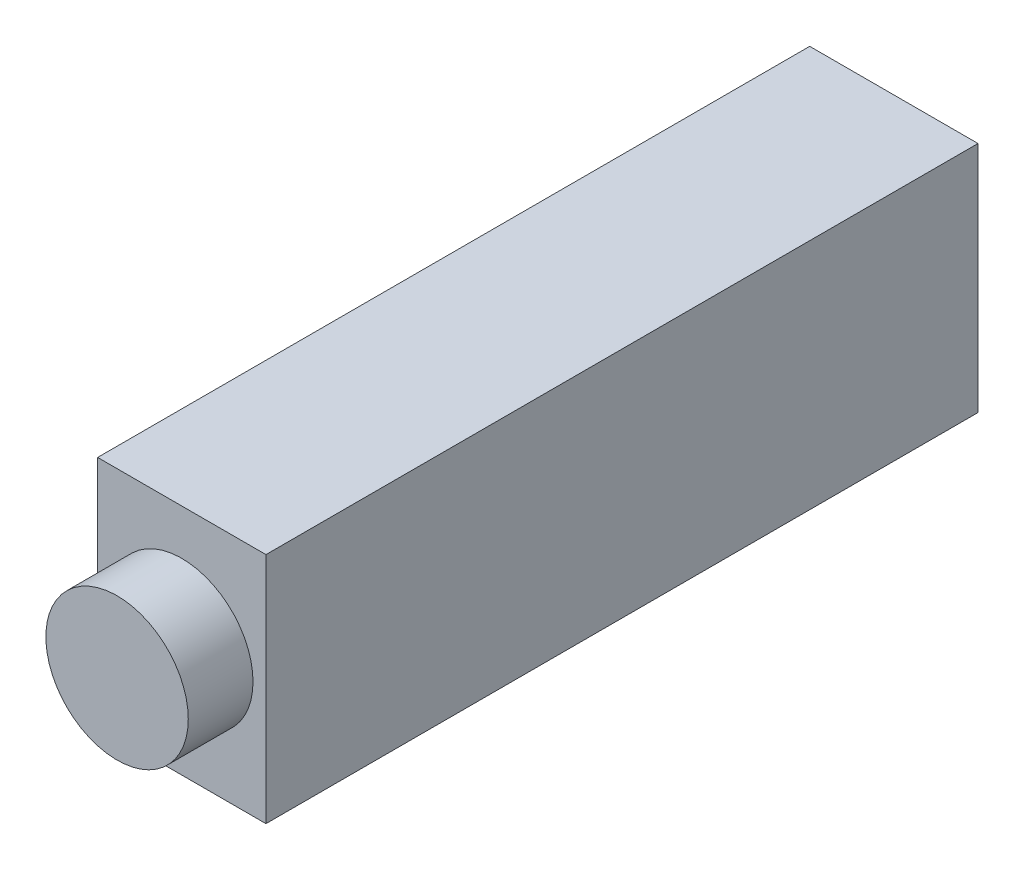
from build123d import *

# Parameters (mm, degrees)
SKETCH1_R           = 11
BOSS_EXTRUDE1_DEPTH = 10
SKETCH3_W           = 26
SKETCH3_H           = 36
BOSS_EXTRUDE2_DEPTH = 110


with BuildPart() as part:
    # Sketch1 → Boss-Extrude1 (new body)
    with BuildSketch(Plane.XY):
        Circle(SKETCH1_R)
    extrude(amount=BOSS_EXTRUDE1_DEPTH)

    # Sketch3 → Boss-Extrude2 (add)
    with BuildSketch(Plane(origin=(0, 0, 0), x_dir=(-1, 0, 0), z_dir=(0, 0, -1))):
        Rectangle(SKETCH3_W, SKETCH3_H)
    extrude(amount=BOSS_EXTRUDE2_DEPTH)


solid = part.part
